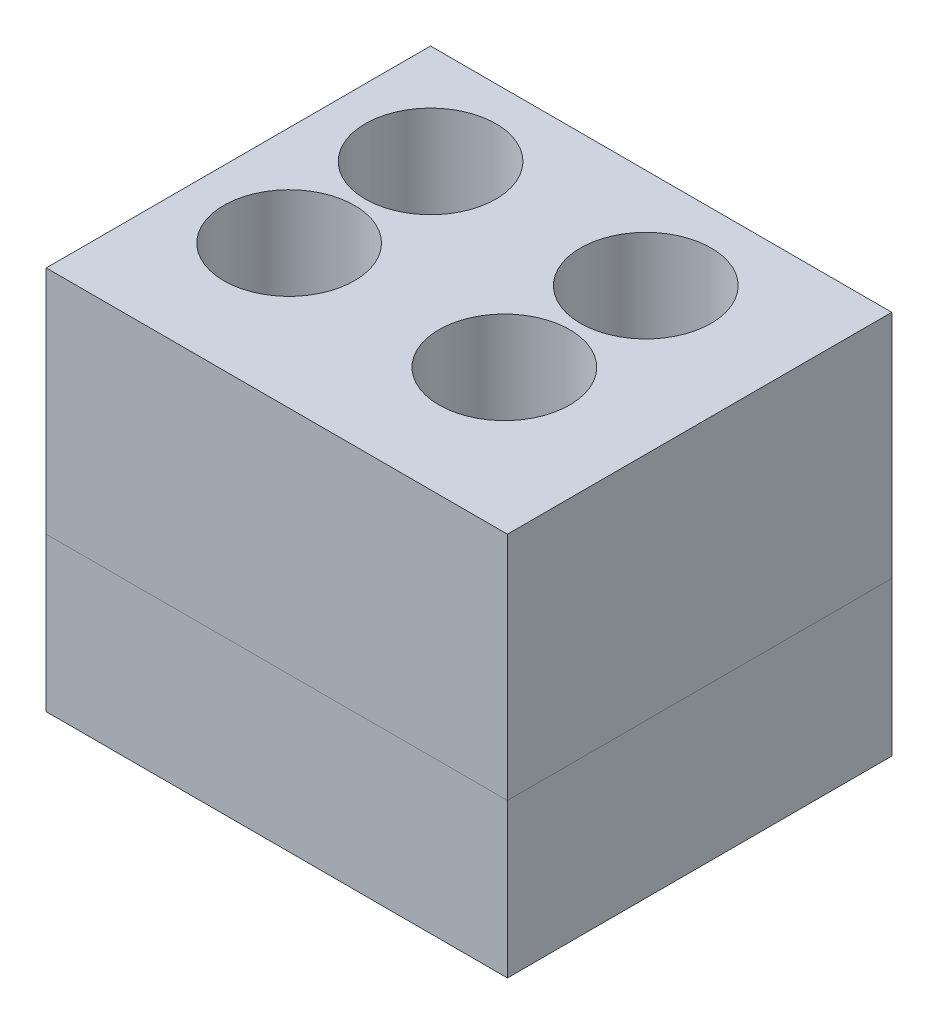
from build123d import *

# Parameters (mm, degrees)
SKETCH2_W             = 30
SKETCH2_H             = 25
SKETCH2_R             = 4.25
BOSS_EXTRUDE1_DEPTH   = 10
SKETCH4_W             = 10.7
SKETCH4_H             = 9
CUT_EXTRUDE1_DEPTH    = 0.2
CUT_EXTRUDE2_DEPTH    = 3
SKETCH6_W             = 5.8
SKETCH6_H             = 1.8
BOSS_EXTRUDE2_DEPTH   = 2.8
SKETCH6_W_2           = 1.8
SKETCH6_H_2           = 5.8
BOSS_EXTRUDE2_2_DEPTH = 2.8
SKETCH8_W             = 30
SKETCH8_H             = 25
SKETCH8_R             = 4.25
BOSS_EXTRUDE3_DEPTH   = 15
SHELL1_DEPTH          = 8.6
SHELL1_2_DEPTH        = 5.8
SHELL1_START          = 8.6
SHELL1_3_DEPTH        = 0.2


# Read off the part's stored shape, not the designer's step: Shell1
with BuildPart() as part:
    # Sketch2 → Boss-Extrude1 (new body)
    with BuildSketch(Plane(origin=(0, 0, 0), x_dir=(1, 0, 0), z_dir=(0, 1, 0))):
        with Locations((15, 12.5)):
            Rectangle(SKETCH2_W, SKETCH2_H)
        with Locations(Location((6.5, 18.5, 0), (0, 0, 270))):
            Circle(SKETCH2_R, mode=Mode.SUBTRACT)
        with Locations(Location((20.5, 18.5, 0), (0, 0, 270))):
            Circle(SKETCH2_R, mode=Mode.SUBTRACT)
        with Locations(Location((20.5, 9.3, 0), (0, 0, 270))):
            Circle(SKETCH2_R, mode=Mode.SUBTRACT)
        with Locations(Location((6.5, 9.3, 0), (0, 0, 270))):
            Circle(SKETCH2_R, mode=Mode.SUBTRACT)
    extrude(amount=BOSS_EXTRUDE1_DEPTH)

    # Sketch4 → Cut-Extrude1 (cut)
    with BuildSketch(Plane(origin=(0, 10, 0), x_dir=(1, 0, 0), z_dir=(0, 1, 0))):
        with Locations((6.5, 18.5)):
            Rectangle(SKETCH4_W, SKETCH4_H)
        with Locations((20.5, 18.5)):
            Rectangle(SKETCH4_W, SKETCH4_H)
        with Locations((20.5, 9.3)):
            Rectangle(SKETCH4_W, SKETCH4_H)
        with Locations((6.5, 9.3)):
            Rectangle(SKETCH4_W, SKETCH4_H)
    extrude(amount=-CUT_EXTRUDE1_DEPTH, mode=Mode.SUBTRACT)

    # Sketch5 → Cut-Extrude2 (cut)
    with BuildSketch(Plane(origin=(0, 10, 0), x_dir=(1, 0, 0), z_dir=(0, 1, 0))):
        with BuildLine():
            Line((3.427313979, 3.4), (8.422686021, 3.4))
            ThreePointArc((8.422686021, 3.4), (9.280189621, 3.755189621), (8.925, 2.897686021))
            Line((8.925, 2.897686021), (8.925, 1.902313979))
            ThreePointArc((8.925, 1.902313979), (9.280189621, 1.044810379), (8.422686021, 1.4))
            Line((8.422686021, 1.4), (3.427313979, 1.4))
            ThreePointArc((3.427313979, 1.4), (2.569810379, 1.044810379), (2.925, 1.902313979))
            Line((2.925, 1.902313979), (2.925, 2.897686021))
            ThreePointArc((2.925, 2.897686021), (2.569810379, 3.755189621), (3.427313979, 3.4))
        make_face()
        with BuildLine():
            Line((27.427313979, 16.5), (28.422686021, 16.5))
            ThreePointArc((28.422686021, 16.5), (29.280189621, 16.144810379), (28.925, 17.002313979))
            Line((28.925, 17.002313979), (28.925, 21.997686021))
            ThreePointArc((28.925, 21.997686021), (29.280189621, 22.855189621), (28.422686021, 22.5))
            Line((28.422686021, 22.5), (27.427313979, 22.5))
            ThreePointArc((27.427313979, 22.5), (26.569810379, 22.855189621), (26.925, 21.997686021))
            Line((26.925, 21.997686021), (26.925, 17.002313979))
            ThreePointArc((26.925, 17.002313979), (26.569810379, 16.144810379), (27.427313979, 16.5))
        make_face()
    extrude(amount=-CUT_EXTRUDE2_DEPTH, mode=Mode.SUBTRACT)

    # Shell1 outline → Shell1 (cut)
    with BuildSketch(Plane(origin=(0, 0, 0), x_dir=(1, 0, 0), z_dir=(0, 1, 0))):
        with BuildLine():
            Line((1.2, 23.8), (1.2, 19.76984251))
            ThreePointArc((1.2, 19.76984251), (2.646268043, 22.353731957), (5.23015749, 23.8))
            Line((5.23015749, 23.8), (1.2, 23.8))
        make_face()
        with BuildLine():
            ThreePointArc((1.2, 10.56984251), (2.0642459, 12.466478417), (3.577244451, 13.9))
            ThreePointArc((3.577244451, 13.9), (2.0642459, 15.333521583), (1.2, 17.23015749))
            Line((1.2, 17.23015749), (1.2, 10.56984251))
        make_face()
        with BuildLine():
            ThreePointArc((7.76984251, 23.8), (11.875590165, 19.397513442), (9.422755549, 13.9))
            ThreePointArc((9.422755549, 13.9), (11.946990168, 9.481102493), (9.721846281, 4.904296809))
            ThreePointArc((9.721846281, 4.904296809), (10.583302066, 3.784586976), (10.302633073, 2.4))
            ThreePointArc((10.302633073, 2.4), (10.572239397, 1.829505823), (10.615524441, 1.2))
            Line((10.615524441, 1.2), (28.8, 1.2))
            Line((28.8, 1.2), (28.8, 14.802281565))
            ThreePointArc((28.8, 14.802281565), (28.340175317, 14.901296471), (27.925, 15.122366927))
            ThreePointArc((27.925, 15.122366927), (26.412160351, 14.876772235), (25.315025831, 15.946957453))
            ThreePointArc((25.315025831, 15.946957453), (24.501977496, 14.8004492), (23.422755549, 13.9))
            ThreePointArc((23.422755549, 13.9), (20.5, 3.85), (17.577244451, 13.9))
            ThreePointArc((17.577244451, 13.9), (15.124409835, 19.397513442), (19.23015749, 23.8))
            Line((19.23015749, 23.8), (7.76984251, 23.8))
        make_face()
        with BuildLine():
            ThreePointArc((3.027851764, 5.099204049), (1.875579151, 6.416038868), (1.2, 8.03015749))
            Line((1.2, 8.03015749), (1.2, 1.2))
            Line((1.2, 1.2), (1.234475559, 1.2))
            ThreePointArc((1.234475559, 1.2), (1.277760603, 1.829505823), (1.547366927, 2.4))
            ThreePointArc((1.547366927, 2.4), (1.432454366, 4.218645475), (3.027851764, 5.099204049))
        make_face()
        with BuildLine():
            ThreePointArc((21.76984251, 23.8), (24.249899714, 22.454839078), (25.725, 20.049798374))
            Line((25.725, 20.049798374), (25.725, 21.29257593))
            ThreePointArc((25.725, 21.29257593), (25.224064461, 22.568492149), (25.825967296, 23.8))
            Line((25.825967296, 23.8), (21.76984251, 23.8))
        make_face()
    extrude(amount=SHELL1_DEPTH, mode=Mode.SUBTRACT)

    # Shell1 2 outline → Shell1 2 (cut)
    with BuildSketch(Plane(origin=(0, 0, 0), x_dir=(1, 0, 0), z_dir=(0, 1, 0))):
        with BuildLine():
            ThreePointArc((10.302633073, 2.4), (10.583302066, 3.784586976), (9.721846281, 4.904296809))
            ThreePointArc((9.721846281, 4.904296809), (6.341381038, 3.852308744), (3.027851764, 5.099204049))
            ThreePointArc((3.027851764, 5.099204049), (1.432454366, 4.218645475), (1.547366927, 2.4))
            ThreePointArc((1.547366927, 2.4), (1.277760603, 1.829505823), (1.234475559, 1.2))
            Line((1.234475559, 1.2), (10.615524441, 1.2))
            ThreePointArc((10.615524441, 1.2), (10.572239397, 1.829505823), (10.302633073, 2.4))
        make_face()
        with BuildLine():
            ThreePointArc((25.315025831, 15.946957453), (26.412160351, 14.876772235), (27.925, 15.122366927))
            ThreePointArc((27.925, 15.122366927), (28.340175317, 14.901296471), (28.8, 14.802281565))
            Line((28.8, 14.802281565), (28.8, 23.8))
            Line((28.8, 23.8), (25.825967296, 23.8))
            ThreePointArc((25.825967296, 23.8), (25.224064461, 22.568492149), (25.725, 21.29257593))
            Line((25.725, 21.29257593), (25.725, 20.049798374))
            ThreePointArc((25.725, 20.049798374), (25.92299323, 17.958110323), (25.315025831, 15.946957453))
        make_face()
    extrude(amount=SHELL1_2_DEPTH, mode=Mode.SUBTRACT)

    # Shell1 3 outline → Shell1 3 (cut)
    with BuildSketch(Plane(origin=(0, 0, 0), x_dir=(1, 0, 0), z_dir=(0, 1, 0)).offset(SHELL1_START)):
        with BuildLine():
            Line((13.95, 23.8), (13.05, 23.8))
            Line((13.05, 23.8), (13.05, 3.6))
            Line((13.05, 3.6), (10.615524441, 3.6))
            ThreePointArc((10.615524441, 3.6), (10.572239397, 2.970494177), (10.302633073, 2.4))
            ThreePointArc((10.302633073, 2.4), (10.572239397, 1.829505823), (10.615524441, 1.2))
            Line((10.615524441, 1.2), (28.8, 1.2))
            Line((28.8, 1.2), (28.8, 14.802281565))
            ThreePointArc((28.8, 14.802281565), (28.340175317, 14.901296471), (27.925, 15.122366927))
            ThreePointArc((27.925, 15.122366927), (27.509824683, 14.901296471), (27.05, 14.802281565))
            Line((27.05, 14.802281565), (27.05, 3.6))
            Line((27.05, 3.6), (13.95, 3.6))
            Line((13.95, 3.6), (13.95, 23.8))
        make_face()
        with BuildLine():
            ThreePointArc((1.547366927, 2.4), (1.277760603, 2.970494177), (1.23447556, 3.6))
            Line((1.23447556, 3.6), (1.2, 3.6))
            Line((1.2, 3.6), (1.2, 1.2))
            Line((1.2, 1.2), (1.234475559, 1.2))
            ThreePointArc((1.234475559, 1.2), (1.277760603, 1.829505823), (1.547366927, 2.4))
        make_face()
    extrude(amount=SHELL1_3_DEPTH, mode=Mode.SUBTRACT)


with BuildPart() as body_2:
    # Sketch6 → Boss-Extrude2 (new body)
    with BuildSketch(Plane(origin=(0, 7, 0), x_dir=(1, 0, 0), z_dir=(0, 1, 0))):
        with Locations((5.925, 2.4)):
            Rectangle(SKETCH6_W, SKETCH6_H)
    extrude(amount=BOSS_EXTRUDE2_DEPTH)


with BuildPart() as body_3:
    # Sketch6 → Boss-Extrude2 2 (new body)
    with BuildSketch(Plane(origin=(0, 7, 0), x_dir=(1, 0, 0), z_dir=(0, 1, 0))):
        with Locations((27.925, 19.5)):
            Rectangle(SKETCH6_W_2, SKETCH6_H_2)
    extrude(amount=BOSS_EXTRUDE2_2_DEPTH)


with BuildPart() as body_3_1:
    # Body-Move/Copy1: moved
    add(body_3.part.moved(Location((0, 0.2, 0))))



with BuildPart() as body_2_1:
    # Body-Move/Copy1: moved
    add(body_2.part.moved(Location((0, 0.2, 0))))


with BuildPart() as body_3_2:
    add(body_3_1.part)

    add(body_2_1.part)  # Boss-Extrude3 merges body 2
    # Sketch8 → Boss-Extrude3 (add)
    with BuildSketch(Plane(origin=(0, 10, 0), x_dir=(1, 0, 0), z_dir=(0, 1, 0))):
        with Locations((15, 12.5)):
            Rectangle(SKETCH8_W, SKETCH8_H)
        with Locations(Location((20.5, 9.3, 0), (0, 0, 270))):
            Circle(SKETCH8_R, mode=Mode.SUBTRACT)
        with Locations(Location((6.5, 9.3, 0), (0, 0, 270))):
            Circle(SKETCH8_R, mode=Mode.SUBTRACT)
        with Locations(Location((20.5, 18.5, 0), (0, 0, 270))):
            Circle(SKETCH8_R, mode=Mode.SUBTRACT)
        with Locations(Location((6.5, 18.5, 0), (0, 0, 270))):
            Circle(SKETCH8_R, mode=Mode.SUBTRACT)
    extrude(amount=BOSS_EXTRUDE3_DEPTH)


solid = Compound([part.part, body_3_2.part])
